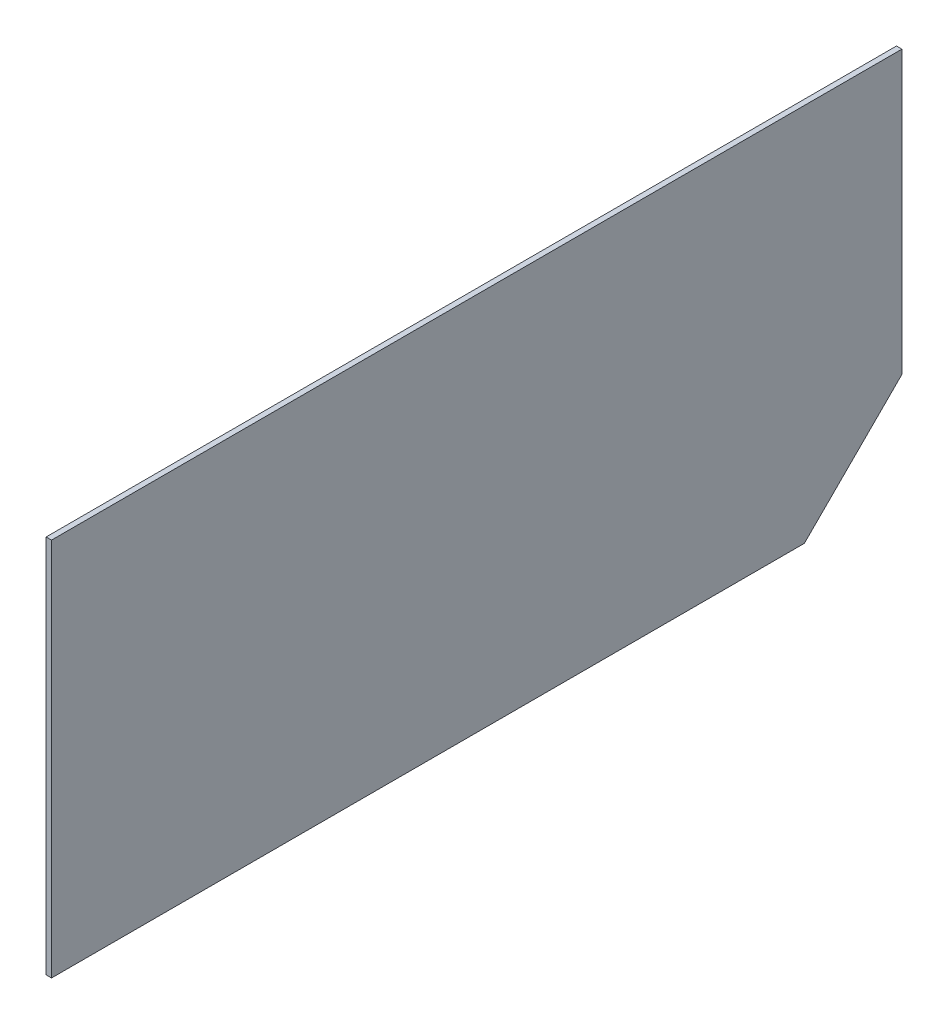
from build123d import *

# Parameters (mm, degrees)
SKETCH1_W           = 498.348
SKETCH1_H           = 165.1
BOSS_EXTRUDE1_DEPTH = 1.5875
BOSS_EXTRUDE2_DEPTH = 3.175


with BuildPart() as part:
    # Sketch1 → Boss-Extrude1 (new, symmetric)
    with BuildSketch(Plane(origin=(0, 0, 0), x_dir=(0, 0, -1), z_dir=(1, 0, 0))):
        Rectangle(SKETCH1_W, SKETCH1_H)
    extrude(amount=BOSS_EXTRUDE1_DEPTH, both=True)

    # Sketch2 → Boss-Extrude2 (add)
    with BuildSketch(Plane(origin=(1.5875, 0, 0), x_dir=(0, 0, -1), z_dir=(1, 0, 0))):
        Polygon((-249.174, -139.7), (192.024, -139.7), (249.174, -82.55), (-249.174, -82.55), align=None)
    extrude(amount=-BOSS_EXTRUDE2_DEPTH)


solid = part.part
